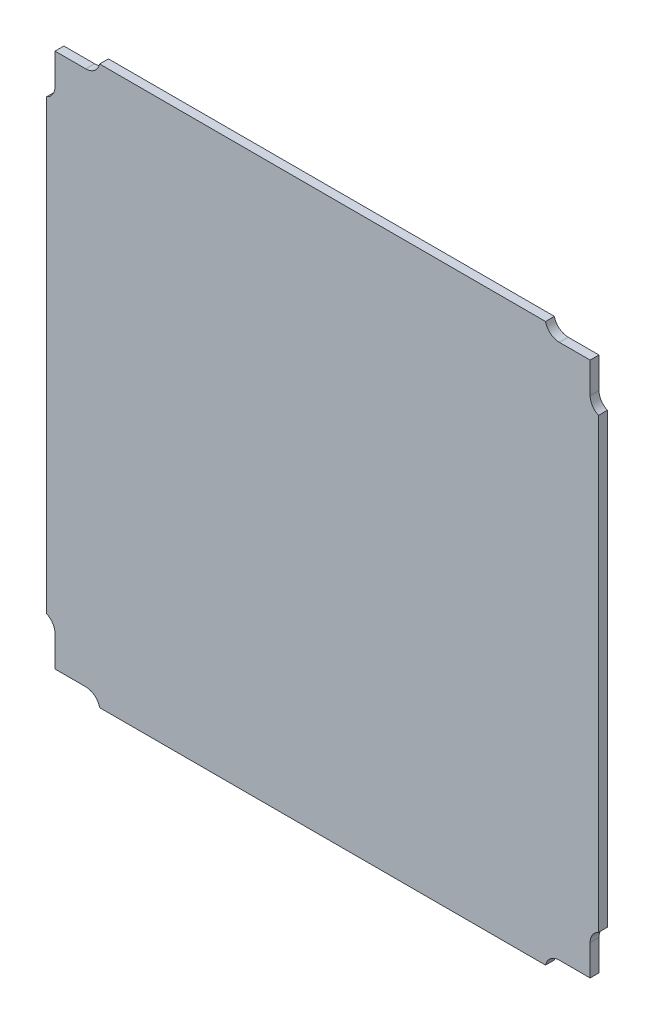
from build123d import *

# Parameters (mm, degrees)
BOSS_EXTRUDE1_DEPTH = 1.5875
FILLET1_R           = 2.54
SKETCH6_OUTSIDE_W   = 130.286
SKETCH6_OUTSIDE_H   = 130.286
SKETCH6_OUTSIDE_W_2 = 99
SKETCH6_OUTSIDE_H_2 = 100
CUT_EXTRUDE2_DEPTH  = 71.728496069
SKETCH7_R           = 38.5
BOSS_EXTRUDE2_DEPTH = 0.1


with BuildPart() as part:
    # Sketch1 → Boss-Extrude1 (new body)
    with BuildSketch(Plane.XY):
        Polygon((40, 50), (-40, 50), (-40, 48), (-48, 48), (-48, 40), (-50, 40), (-50, -37.864895224), (-50, -40), (-48, -40), (-48, -48), (-40, -48), (-40, -50), (-37.864895224, -50), (40, -50), (40, -48), (48, -48), (48, -40), (50, -40), (50, 40), (48, 40), (48, 48), (40, 48), align=None)
    extrude(amount=BOSS_EXTRUDE1_DEPTH)

    # Fillet1
    # the kernel refuses this fillet: 2.54 mm, written as the material it adds along each edge
    with BuildSketch(Plane(origin=(-48, -40, 0), x_dir=(0, -1, 0), z_dir=(0, 0, 1)), Plane(origin=(40, -48, 0), x_dir=(1, 0, 0), z_dir=(0, 0, 1)), Plane(origin=(48, 40, 0), x_dir=(0, 1, 0), z_dir=(0, 0, 1)), Plane(origin=(-40, 48, 0), x_dir=(-1, 0, 0), z_dir=(0, 0, 1))) as fillet1_piece_1:
        with BuildLine():
            CenterArc((2.481934729, -2.54), FILLET1_R, 90, 77.725329785)
            Line((0, -2), (-0.049638695, -1.9892))
            ThreePointArc((-0.049638695, -1.9892), (-0.0508, -1), (-0.0508, 0))
            Line((-0.0508, 0), (0, 0.0508))
            Line((0, 0.0508), (2.481934729, 0.0508))
            Line((2.481934729, 0.0508), (2.481934729, 0))
        make_face()
    extrude(amount=1.5875)
    with BuildSketch(Plane(origin=(-40, -48, 0), x_dir=(-3.737454790095179e-12, -1.0, 0), z_dir=(0, 0, 1)), Plane(origin=(48, -40, 0), x_dir=(1.0, -3.7339020764163554e-12, 0), z_dir=(0, 0, 1)), Plane(origin=(-48, 40, 0), x_dir=(-1.0, 3.737454790095126e-12, 0), z_dir=(0, 0, 1))) as fillet1_piece_2:
        with BuildLine():
            CenterArc((2.54, -2.481934729), FILLET1_R, 102.274670215, 77.725329785)
            Line((0, -2.481934729), (-0.0508, -2.481934729))
            Line((-0.0508, -2.481934729), (-0.0508, 0))
            Line((-0.0508, 0), (0, 0.0508))
            ThreePointArc((0, 0.0508), (1, 0.0508), (1.9892, 0.049638695))
            Line((1.9892, 0.049638695), (2, 0))
        make_face()
    extrude(amount=1.5875)
    with BuildSketch(Plane(origin=(40, 48, 0), x_dir=(1, 0, 0), z_dir=(0, 0, 1))) as fillet1_piece_3:
        with BuildLine():
            CenterArc((2.481934729, 2.54), FILLET1_R, 192.274670215, 77.725329785)
            Line((0, 2), (-0.049638695, 1.9892))
            ThreePointArc((-0.049638695, 1.9892), (-0.0508, 1), (-0.0508, 0))
            Line((-0.0508, 0), (0, -0.0508))
            Line((0, -0.0508), (2.481934729, -0.0508))
            Line((2.481934729, -0.0508), (2.481934729, 0))
        make_face()
    extrude(amount=1.5875)

    # Sketch6 outside → Cut-Extrude2 (cut, through all)
    with BuildSketch(Plane.XY.offset(1.5875)):
        Rectangle(SKETCH6_OUTSIDE_W, SKETCH6_OUTSIDE_H)
        Rectangle(SKETCH6_OUTSIDE_W_2, SKETCH6_OUTSIDE_H_2, mode=Mode.SUBTRACT)
    extrude(amount=-CUT_EXTRUDE2_DEPTH, mode=Mode.SUBTRACT)

    # Sketch7 → Boss-Extrude2 (add)
    with BuildSketch(Plane(origin=(0, 0, 0), x_dir=(-1, 0, 0), z_dir=(0, 0, -1))):
        with Locations(Location((0, 0, 0), (0, 0, 180))):
            Circle(SKETCH7_R)
    extrude(amount=BOSS_EXTRUDE2_DEPTH)


solid = part.part
